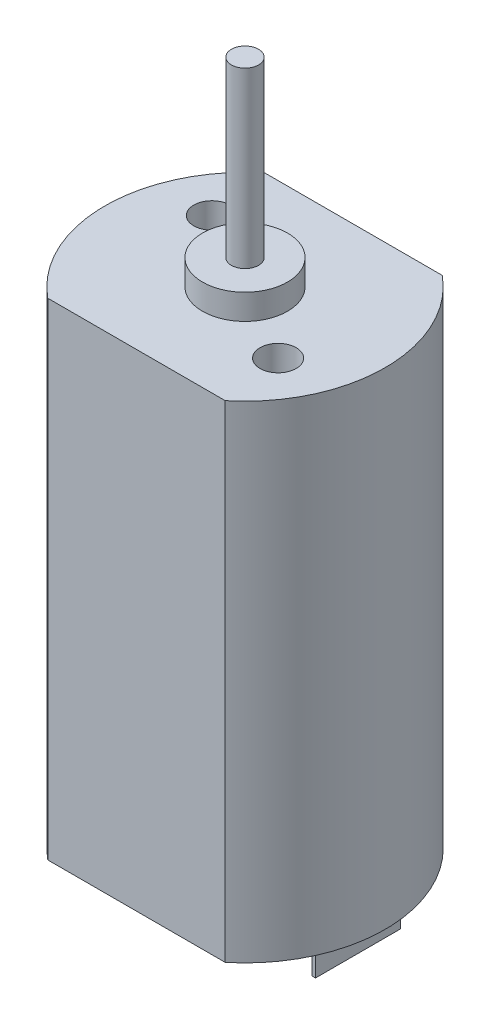
from build123d import *

# Parameters (mm, degrees)
BOSS_EXTRUDE1_DEPTH = 13.45
SKETCH2_R           = 2.35
BOSS_EXTRUDE2_DEPTH = 1.4
SKETCH3_R           = 0.75
BOSS_EXTRUDE5_DEPTH = 9.6
SKETCH4_W           = 0.2
SKETCH4_H           = 4.7
BOSS_EXTRUDE6_DEPTH = 1.9
SKETCH5_R           = 1
CUT_EXTRUDE1_DEPTH  = 1.9


with BuildPart() as part:
    # Sketch1 → Boss-Extrude1 (new, symmetric)
    with BuildSketch(Plane(origin=(0, 0, 0), x_dir=(1, 0, 0), z_dir=(0, 1, 0))):
        with BuildLine():
            Line((-4.905354218, 6), (4.905354218, 6))
            ThreePointArc((4.905354218, 6), (7.75, 0), (4.905354218, -6))
            Line((4.905354218, -6), (-4.905354218, -6))
            ThreePointArc((-4.905354218, -6), (-7.75, 0), (-4.905354218, 6))
        make_face()
    extrude(amount=BOSS_EXTRUDE1_DEPTH, both=True)

    # Sketch2 → Boss-Extrude2 (add)
    with BuildSketch(Plane(origin=(0, 13.45, 0), x_dir=(1, 0, 0), z_dir=(0, 1, 0))):
        Circle(SKETCH2_R)
    extrude(amount=BOSS_EXTRUDE2_DEPTH)

    # Sketch3 → Boss-Extrude5 (add)
    with BuildSketch(Plane(origin=(0, 14.85, 0), x_dir=(1, 0, 0), z_dir=(0, 1, 0))):
        Circle(SKETCH3_R)
    extrude(amount=BOSS_EXTRUDE5_DEPTH)

    # Sketch4 → Boss-Extrude6 (add)
    with BuildSketch(Plane.XZ.offset(13.45)):
        with Locations((-6.15, 0)):
            Rectangle(SKETCH4_W, SKETCH4_H)
        with Locations((6.15, 0)):
            Rectangle(SKETCH4_W, SKETCH4_H)
    extrude(amount=BOSS_EXTRUDE6_DEPTH)

    # Sketch5 → Cut-Extrude1 (cut)
    with BuildSketch(Plane(origin=(0, 13.45, 0), x_dir=(1, 0, 0), z_dir=(0, 1, 0))):
        with Locations((-4.330127019, 2.5)):
            Circle(SKETCH5_R)
        with Locations((4.330127019, -2.5)):
            Circle(SKETCH5_R)
    extrude(amount=-CUT_EXTRUDE1_DEPTH, mode=Mode.SUBTRACT)


solid = part.part
